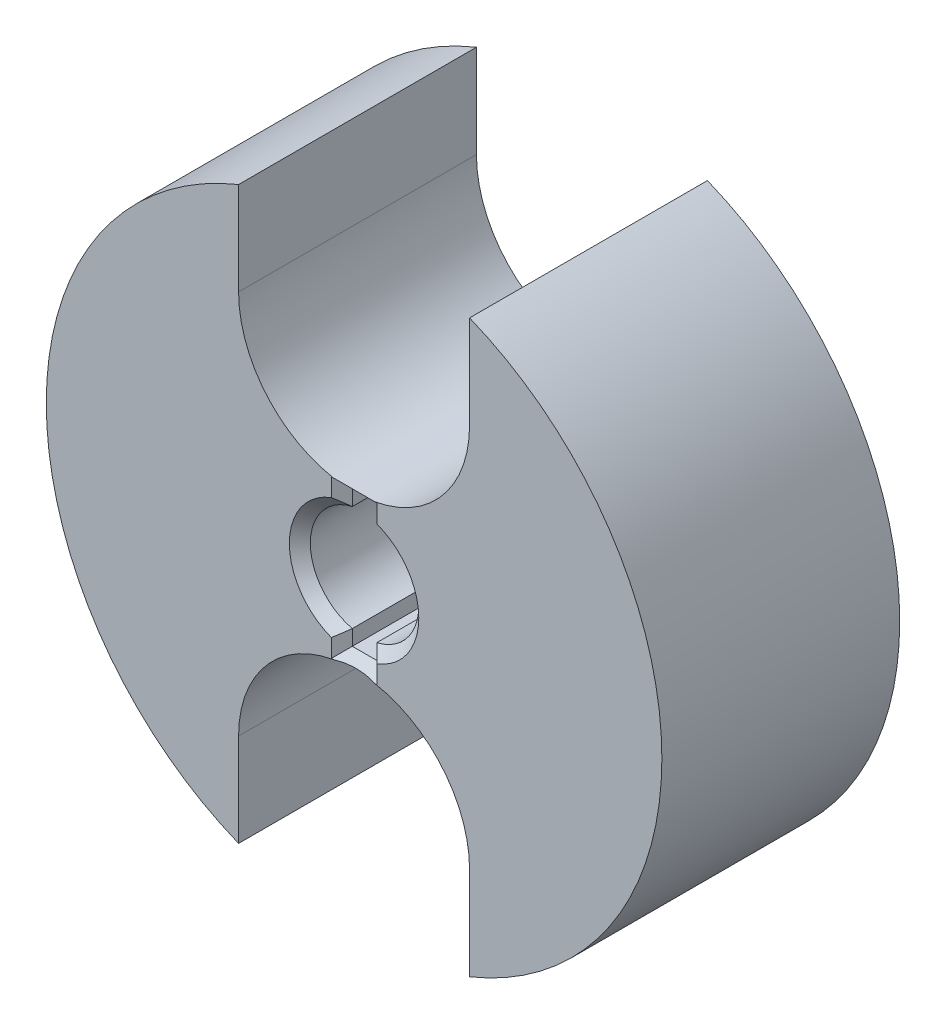
from build123d import *

# Parameters (mm, degrees)
BOSS_EXTRUDE1_DEPTH = 17
CHAMFER1_SIZE       = 0.75
CHAMFER2_SIZE       = 0.75


with BuildPart() as part:
    # Sketch1 → Boss-Extrude1 (new body)
    # profile 1 of 3: a face of its own
    with BuildSketch(Plane.XY):
        with BuildLine():
            Line((-8.255, 13.745), (-8.255, 20.392522527))
            ThreePointArc((-8.255, 20.392522527), (-22, 0), (-8.255, -20.392522527))
            Line((-8.255, -20.392522527), (-8.255, -13.745000015))
            Line((-8.255, -13.745000015), (-8.255, 13.745))
        make_face()
    # profile 2 of 3: a face of its own
    with BuildSketch(Plane.XY):
        with BuildLine():
            ThreePointArc((22, 0), (18.242943841, 12.296137605), (8.255, 20.392522527))
            Line((8.255, 20.392522527), (8.255, 13.745))
            Line((8.255, 13.745), (8.255, -13.745))
            Line((8.255, -13.745), (8.255, -20.392522527))
            ThreePointArc((8.255, -20.392522527), (18.242943841, -12.296137605), (22, 0))
        make_face()
    # profile 3 of 3: a face of its own
    with BuildSketch(Plane.XY):
        with BuildLine():
            ThreePointArc((8.255, 13.745), (0, 5.49), (-8.255, 13.745))
            Line((-8.255, 13.745), (-8.255, -13.745000015))
            ThreePointArc((-8.255, -13.745000015), (-7e-09, -5.49), (8.255, -13.745))
            Line((8.255, -13.745), (8.255, 13.745))
        make_face()
        with BuildLine():
            Line((-0.875, 3.774917218), (-0.875, 4.875))
            Line((-0.875, 4.875), (0.875, 4.875))
            Line((0.875, 4.875), (0.875, 3.774917218))
            ThreePointArc((0.875, 3.774917218), (3.033665275, 2.41091269), (3.875, 0))
            ThreePointArc((3.875, 0), (3.033665275, -2.41091269), (0.875, -3.774917218))
            Line((0.875, -3.774917218), (0.875, -4.875))
            Line((0.875, -4.875), (-0.875, -4.875))
            Line((-0.875, -4.875), (-0.875, -3.774917218))
            ThreePointArc((-0.875, -3.774917218), (-3.875, 0), (-0.875, 3.774917218))
        make_face(mode=Mode.SUBTRACT)
    extrude(amount=BOSS_EXTRUDE1_DEPTH)

    # Chamfer1
    # the kernel refuses this chamfer: 0.75 mm, written as the material it takes off along each edge
    with BuildSketch(Plane(origin=(-0.875, -4.875, 0), x_dir=(-1, 0, 0), z_dir=(0, 1, 0)), Plane(origin=(0.875, -1.846154977, 0), x_dir=(1, 0, 0), z_dir=(0, -1, 0)), Plane(origin=(0.875, 4.875, 0), x_dir=(1, 0, 0), z_dir=(0, -1, 0)), Plane(origin=(-0.875, 1.846154977, 0), x_dir=(-1, 0, 0), z_dir=(0, 1, 0))) as chamfer1_piece_1:
        Polygon((CHAMFER1_SIZE, 0), (0, CHAMFER1_SIZE), (0, 0), align=None)
    extrude(amount=3.028845023, mode=Mode.SUBTRACT)
    with BuildSketch(Plane(origin=(0.875, -4.875, 0), x_dir=(0, -1, 0), z_dir=(-1, 0, 0)), Plane(origin=(-0.875, 4.875, 0), x_dir=(0, 1, 0), z_dir=(1, 0, 0))) as chamfer1_piece_2:
        Polygon((CHAMFER1_SIZE, 0), (0, CHAMFER1_SIZE), (0, 0), align=None)
    extrude(amount=1.75, mode=Mode.SUBTRACT)
    with BuildSketch(Plane(origin=(0, 0, 0), x_dir=(-0.26727041794230744, 0.9636215666395933, 0), z_dir=(-0.9636215666395933, -0.26727041794230744, 0))) as chamfer1_piece_3:
        Polygon((3.875 + CHAMFER1_SIZE, 0), (3.875, -CHAMFER1_SIZE), (3.875, 0), align=None)
    revolve(axis=Axis((0, 0, 0), (0, 0, -1)), revolution_arc=211.003810324, mode=Mode.SUBTRACT)
    with BuildSketch(Plane(origin=(0, 0, 0), x_dir=(0.2672704179423268, -0.963621566639588, 0), z_dir=(0.963621566639588, 0.2672704179423268, 0))) as chamfer1_piece_4:
        Polygon((3.875 + CHAMFER1_SIZE, 0), (3.875, -CHAMFER1_SIZE), (3.875, 0), align=None)
    revolve(axis=Axis((0, 0, 0), (0, 0, -1)), revolution_arc=211.003810324, mode=Mode.SUBTRACT)
    with BuildSketch(Plane(origin=(0.875, -4.875, 0), x_dir=(0, -1, 0), z_dir=(-1, 0, 0))) as chamfer1_piece_5a_section:
        Polygon((CHAMFER1_SIZE, 0), (0, CHAMFER1_SIZE), (0, 0), align=None)
    chamfer1_piece_5a = extrude(amount=3.678762241, mode=Mode.PRIVATE)
    chamfer1_piece_5a = chamfer1_piece_5a - Plane(origin=(0, -13.745, 0), x_dir=(-1.0, -1.8151489867665974e-09, 0), z_dir=(0, 0, -1)) * Cylinder(8.255, 11, mode=Mode.PRIVATE)
    chamfer1_piece_5a = split(chamfer1_piece_5a, bisect_by=Plane(origin=(-0.875, -4.875, 0), z_dir=(-1, 0, 0)), keep=Keep.TOP, mode=Mode.PRIVATE)
    with BuildSketch(Plane(origin=(-0.875, -6.803762241, 0), x_dir=(-1, 0, 0), z_dir=(0, 1, 0))) as chamfer1_piece_5b_section:
        Polygon((CHAMFER1_SIZE, 0), (0, CHAMFER1_SIZE), (0, 0), align=None)
    chamfer1_piece_5b = extrude(amount=4.957607264, mode=Mode.PRIVATE)
    chamfer1_piece_5b = chamfer1_piece_5b - Plane(origin=(0, -13.745, 0), x_dir=(-1.0, -1.8151489867665974e-09, 0), z_dir=(0, 0, -1)) * Cylinder(8.255, 13, mode=Mode.PRIVATE)
    chamfer1_piece_5b = split(chamfer1_piece_5b, bisect_by=Plane(origin=(-0.875, -4.875, 0), z_dir=(0, -1, 0)), keep=Keep.TOP, mode=Mode.PRIVATE)
    chamfer1_piece_5 = chamfer1_piece_5a & chamfer1_piece_5b
    add(chamfer1_piece_5, mode=Mode.SUBTRACT)
    with BuildSketch(Plane(origin=(0.875, -1.846154977, 0), x_dir=(1, 0, 0), z_dir=(0, -1, 0))) as chamfer1_piece_6a_section:
        Polygon((CHAMFER1_SIZE, 0), (0, CHAMFER1_SIZE), (0, 0), align=None)
    chamfer1_piece_6a = extrude(amount=4.957607264, mode=Mode.PRIVATE)
    chamfer1_piece_6a = chamfer1_piece_6a - Plane(origin=(0, -13.745, 0), x_dir=(-1.0, -1.8151489867665974e-09, 0), z_dir=(0, 0, -1)) * Cylinder(8.255, 13, mode=Mode.PRIVATE)
    chamfer1_piece_6a = split(chamfer1_piece_6a, bisect_by=Plane(origin=(0.875, -4.875, 0), z_dir=(0, -1, 0)), keep=Keep.TOP, mode=Mode.PRIVATE)
    with BuildSketch(Plane(origin=(2.803762241, -4.875, 0), x_dir=(0, -1, 0), z_dir=(-1, 0, 0))) as chamfer1_piece_6b_section:
        Polygon((CHAMFER1_SIZE, 0), (0, CHAMFER1_SIZE), (0, 0), align=None)
    chamfer1_piece_6b = extrude(amount=3.678762241, mode=Mode.PRIVATE)
    chamfer1_piece_6b = chamfer1_piece_6b - Plane(origin=(0, -13.745, 0), x_dir=(-1.0, -1.8151489867665974e-09, 0), z_dir=(0, 0, -1)) * Cylinder(8.255, 11, mode=Mode.PRIVATE)
    chamfer1_piece_6b = split(chamfer1_piece_6b, bisect_by=Plane(origin=(0.875, -4.875, 0), z_dir=(1, 0, 0)), keep=Keep.TOP, mode=Mode.PRIVATE)
    chamfer1_piece_6 = chamfer1_piece_6a & chamfer1_piece_6b
    add(chamfer1_piece_6, mode=Mode.SUBTRACT)
    with BuildSketch(Plane(origin=(-0.875, 4.875, 0), x_dir=(0, 1, 0), z_dir=(1, 0, 0))) as chamfer1_piece_7a_section:
        Polygon((CHAMFER1_SIZE, 0), (0, CHAMFER1_SIZE), (0, 0), align=None)
    chamfer1_piece_7a = extrude(amount=3.678762241, mode=Mode.PRIVATE)
    chamfer1_piece_7a = chamfer1_piece_7a - Plane(origin=(0, 13.745, 0), x_dir=(1, 0, 0), z_dir=(0, 0, -1)) * Cylinder(8.255, 11, mode=Mode.PRIVATE)
    chamfer1_piece_7a = split(chamfer1_piece_7a, bisect_by=Plane(origin=(0.875, 4.875, 0), z_dir=(1, 0, 0)), keep=Keep.TOP, mode=Mode.PRIVATE)
    with BuildSketch(Plane(origin=(0.875, 6.803762241, 0), x_dir=(1, 0, 0), z_dir=(0, -1, 0))) as chamfer1_piece_7b_section:
        Polygon((CHAMFER1_SIZE, 0), (0, CHAMFER1_SIZE), (0, 0), align=None)
    chamfer1_piece_7b = extrude(amount=4.957607264, mode=Mode.PRIVATE)
    chamfer1_piece_7b = chamfer1_piece_7b - Plane(origin=(0, 13.745, 0), x_dir=(1, 0, 0), z_dir=(0, 0, -1)) * Cylinder(8.255, 13, mode=Mode.PRIVATE)
    chamfer1_piece_7b = split(chamfer1_piece_7b, bisect_by=Plane(origin=(0.875, 4.875, 0), z_dir=(0, 1, 0)), keep=Keep.TOP, mode=Mode.PRIVATE)
    chamfer1_piece_7 = chamfer1_piece_7a & chamfer1_piece_7b
    add(chamfer1_piece_7, mode=Mode.SUBTRACT)
    with BuildSketch(Plane(origin=(-0.875, 1.846154977, 0), x_dir=(-1, 0, 0), z_dir=(0, 1, 0))) as chamfer1_piece_8a_section:
        Polygon((CHAMFER1_SIZE, 0), (0, CHAMFER1_SIZE), (0, 0), align=None)
    chamfer1_piece_8a = extrude(amount=4.957607264, mode=Mode.PRIVATE)
    chamfer1_piece_8a = chamfer1_piece_8a - Plane(origin=(0, 13.745, 0), x_dir=(1, 0, 0), z_dir=(0, 0, -1)) * Cylinder(8.255, 13, mode=Mode.PRIVATE)
    chamfer1_piece_8a = split(chamfer1_piece_8a, bisect_by=Plane(origin=(-0.875, 4.875, 0), z_dir=(0, 1, 0)), keep=Keep.TOP, mode=Mode.PRIVATE)
    with BuildSketch(Plane(origin=(-2.803762241, 4.875, 0), x_dir=(0, 1, 0), z_dir=(1, 0, 0))) as chamfer1_piece_8b_section:
        Polygon((CHAMFER1_SIZE, 0), (0, CHAMFER1_SIZE), (0, 0), align=None)
    chamfer1_piece_8b = extrude(amount=3.678762241, mode=Mode.PRIVATE)
    chamfer1_piece_8b = chamfer1_piece_8b - Plane(origin=(0, 13.745, 0), x_dir=(1, 0, 0), z_dir=(0, 0, -1)) * Cylinder(8.255, 11, mode=Mode.PRIVATE)
    chamfer1_piece_8b = split(chamfer1_piece_8b, bisect_by=Plane(origin=(-0.875, 4.875, 0), z_dir=(-1, 0, 0)), keep=Keep.TOP, mode=Mode.PRIVATE)
    chamfer1_piece_8 = chamfer1_piece_8a & chamfer1_piece_8b
    add(chamfer1_piece_8, mode=Mode.SUBTRACT)

    # Chamfer2
    # the kernel refuses this chamfer: 0.75 mm, written as the material it takes off along each edge
    with BuildSketch(Plane(origin=(0, 0, 17), x_dir=(0.2672704179423268, -0.963621566639588, 0), z_dir=(0.963621566639588, 0.2672704179423268, 0))) as chamfer2_piece_1:
        Polygon((3.875 + CHAMFER2_SIZE, 0), (3.875, CHAMFER2_SIZE), (3.875, 0), align=None)
    revolve(axis=Axis((0, 0, 17), (0, 0, -1)), revolution_arc=211.003810324, mode=Mode.SUBTRACT)
    with BuildSketch(Plane(origin=(-0.875, 1.846154977, 17), x_dir=(-1, 0, 0), z_dir=(0, 1, 0)), Plane(origin=(0.875, 4.875, 17), x_dir=(1, 0, 0), z_dir=(0, -1, 0)), Plane(origin=(0.875, -1.846154977, 17), x_dir=(1, 0, 0), z_dir=(0, -1, 0)), Plane(origin=(-0.875, -4.875, 17), x_dir=(-1, 0, 0), z_dir=(0, 1, 0))) as chamfer2_piece_2:
        Polygon((CHAMFER2_SIZE, 0), (0, -CHAMFER2_SIZE), (0, 0), align=None)
    extrude(amount=3.028845023, mode=Mode.SUBTRACT)
    with BuildSketch(Plane(origin=(-0.875, 4.875, 17), x_dir=(0, 1, 0), z_dir=(1, 0, 0)), Plane(origin=(0.875, -4.875, 17), x_dir=(0, -1, 0), z_dir=(-1, 0, 0))) as chamfer2_piece_3:
        Polygon((CHAMFER2_SIZE, 0), (0, -CHAMFER2_SIZE), (0, 0), align=None)
    extrude(amount=1.75, mode=Mode.SUBTRACT)
    with BuildSketch(Plane(origin=(0, 0, 17), x_dir=(-0.26727041794230755, -0.9636215666395933, 0), z_dir=(-0.9636215666395933, 0.26727041794230755, 0))) as chamfer2_piece_4:
        Polygon((3.875 + CHAMFER2_SIZE, 0), (3.875, -CHAMFER2_SIZE), (3.875, 0), align=None)
    revolve(axis=Axis((0, 0, 17), (0, 0, 1)), revolution_arc=211.003810324, mode=Mode.SUBTRACT)
    with BuildSketch(Plane(origin=(-0.875, 1.846154977, 17), x_dir=(-1, 0, 0), z_dir=(0, 1, 0))) as chamfer2_piece_5a_section:
        Polygon((CHAMFER2_SIZE, 0), (0, -CHAMFER2_SIZE), (0, 0), align=None)
    chamfer2_piece_5a = extrude(amount=4.957607264, mode=Mode.PRIVATE)
    chamfer2_piece_5a = split(chamfer2_piece_5a, bisect_by=Plane(origin=(-0.875, 4.875, 17), z_dir=(0, 1, 0)), keep=Keep.TOP, mode=Mode.PRIVATE)
    chamfer2_piece_5a = chamfer2_piece_5a - Plane(origin=(0, 13.745, 17), x_dir=(1, 0, 0), z_dir=(0, 0, -1)) * Cylinder(8.255, 13, mode=Mode.PRIVATE)
    with BuildSketch(Plane(origin=(-2.803762241, 4.875, 17), x_dir=(0, 1, 0), z_dir=(1, 0, 0))) as chamfer2_piece_5b_section:
        Polygon((CHAMFER2_SIZE, 0), (0, -CHAMFER2_SIZE), (0, 0), align=None)
    chamfer2_piece_5b = extrude(amount=3.678762241, mode=Mode.PRIVATE)
    chamfer2_piece_5b = split(chamfer2_piece_5b, bisect_by=Plane(origin=(-0.875, 4.875, 17), z_dir=(-1, 0, 0)), keep=Keep.TOP, mode=Mode.PRIVATE)
    chamfer2_piece_5b = chamfer2_piece_5b - Plane(origin=(0, 13.745, 17), x_dir=(1, 0, 0), z_dir=(0, 0, -1)) * Cylinder(8.255, 11, mode=Mode.PRIVATE)
    chamfer2_piece_5 = chamfer2_piece_5a & chamfer2_piece_5b
    add(chamfer2_piece_5, mode=Mode.SUBTRACT)
    with BuildSketch(Plane(origin=(-0.875, 4.875, 17), x_dir=(0, 1, 0), z_dir=(1, 0, 0))) as chamfer2_piece_6a_section:
        Polygon((CHAMFER2_SIZE, 0), (0, -CHAMFER2_SIZE), (0, 0), align=None)
    chamfer2_piece_6a = extrude(amount=3.678762241, mode=Mode.PRIVATE)
    chamfer2_piece_6a = split(chamfer2_piece_6a, bisect_by=Plane(origin=(0.875, 4.875, 17), z_dir=(1, 0, 0)), keep=Keep.TOP, mode=Mode.PRIVATE)
    chamfer2_piece_6a = chamfer2_piece_6a - Plane(origin=(0, 13.745, 17), x_dir=(1, 0, 0), z_dir=(0, 0, -1)) * Cylinder(8.255, 11, mode=Mode.PRIVATE)
    with BuildSketch(Plane(origin=(0.875, 6.803762241, 17), x_dir=(1, 0, 0), z_dir=(0, -1, 0))) as chamfer2_piece_6b_section:
        Polygon((CHAMFER2_SIZE, 0), (0, -CHAMFER2_SIZE), (0, 0), align=None)
    chamfer2_piece_6b = extrude(amount=4.957607264, mode=Mode.PRIVATE)
    chamfer2_piece_6b = split(chamfer2_piece_6b, bisect_by=Plane(origin=(0.875, 4.875, 17), z_dir=(0, 1, 0)), keep=Keep.TOP, mode=Mode.PRIVATE)
    chamfer2_piece_6b = chamfer2_piece_6b - Plane(origin=(0, 13.745, 17), x_dir=(1, 0, 0), z_dir=(0, 0, -1)) * Cylinder(8.255, 13, mode=Mode.PRIVATE)
    chamfer2_piece_6 = chamfer2_piece_6a & chamfer2_piece_6b
    add(chamfer2_piece_6, mode=Mode.SUBTRACT)
    with BuildSketch(Plane(origin=(0.875, -1.846154977, 17), x_dir=(1, 0, 0), z_dir=(0, -1, 0))) as chamfer2_piece_7a_section:
        Polygon((CHAMFER2_SIZE, 0), (0, -CHAMFER2_SIZE), (0, 0), align=None)
    chamfer2_piece_7a = extrude(amount=4.957607264, mode=Mode.PRIVATE)
    chamfer2_piece_7a = split(chamfer2_piece_7a, bisect_by=Plane(origin=(0.875, -4.875, 17), z_dir=(0, -1, 0)), keep=Keep.TOP, mode=Mode.PRIVATE)
    chamfer2_piece_7a = chamfer2_piece_7a - Plane(origin=(0, -13.745, 17), x_dir=(-1.0, -1.8151489867665974e-09, 0), z_dir=(0, 0, -1)) * Cylinder(8.255, 13, mode=Mode.PRIVATE)
    with BuildSketch(Plane(origin=(2.803762241, -4.875, 17), x_dir=(0, -1, 0), z_dir=(-1, 0, 0))) as chamfer2_piece_7b_section:
        Polygon((CHAMFER2_SIZE, 0), (0, -CHAMFER2_SIZE), (0, 0), align=None)
    chamfer2_piece_7b = extrude(amount=3.678762241, mode=Mode.PRIVATE)
    chamfer2_piece_7b = split(chamfer2_piece_7b, bisect_by=Plane(origin=(0.875, -4.875, 17), z_dir=(1, 0, 0)), keep=Keep.TOP, mode=Mode.PRIVATE)
    chamfer2_piece_7b = chamfer2_piece_7b - Plane(origin=(0, -13.745, 17), x_dir=(-1.0, -1.8151489867665974e-09, 0), z_dir=(0, 0, -1)) * Cylinder(8.255, 11, mode=Mode.PRIVATE)
    chamfer2_piece_7 = chamfer2_piece_7a & chamfer2_piece_7b
    add(chamfer2_piece_7, mode=Mode.SUBTRACT)
    with BuildSketch(Plane(origin=(0.875, -4.875, 17), x_dir=(0, -1, 0), z_dir=(-1, 0, 0))) as chamfer2_piece_8a_section:
        Polygon((CHAMFER2_SIZE, 0), (0, -CHAMFER2_SIZE), (0, 0), align=None)
    chamfer2_piece_8a = extrude(amount=3.678762241, mode=Mode.PRIVATE)
    chamfer2_piece_8a = split(chamfer2_piece_8a, bisect_by=Plane(origin=(-0.875, -4.875, 17), z_dir=(-1, 0, 0)), keep=Keep.TOP, mode=Mode.PRIVATE)
    chamfer2_piece_8a = chamfer2_piece_8a - Plane(origin=(0, -13.745, 17), x_dir=(-1.0, -1.8151489867665974e-09, 0), z_dir=(0, 0, -1)) * Cylinder(8.255, 11, mode=Mode.PRIVATE)
    with BuildSketch(Plane(origin=(-0.875, -6.803762241, 17), x_dir=(-1, 0, 0), z_dir=(0, 1, 0))) as chamfer2_piece_8b_section:
        Polygon((CHAMFER2_SIZE, 0), (0, -CHAMFER2_SIZE), (0, 0), align=None)
    chamfer2_piece_8b = extrude(amount=4.957607264, mode=Mode.PRIVATE)
    chamfer2_piece_8b = split(chamfer2_piece_8b, bisect_by=Plane(origin=(-0.875, -4.875, 17), z_dir=(0, -1, 0)), keep=Keep.TOP, mode=Mode.PRIVATE)
    chamfer2_piece_8b = chamfer2_piece_8b - Plane(origin=(0, -13.745, 17), x_dir=(-1.0, -1.8151489867665974e-09, 0), z_dir=(0, 0, -1)) * Cylinder(8.255, 13, mode=Mode.PRIVATE)
    chamfer2_piece_8 = chamfer2_piece_8a & chamfer2_piece_8b
    add(chamfer2_piece_8, mode=Mode.SUBTRACT)


solid = part.part
